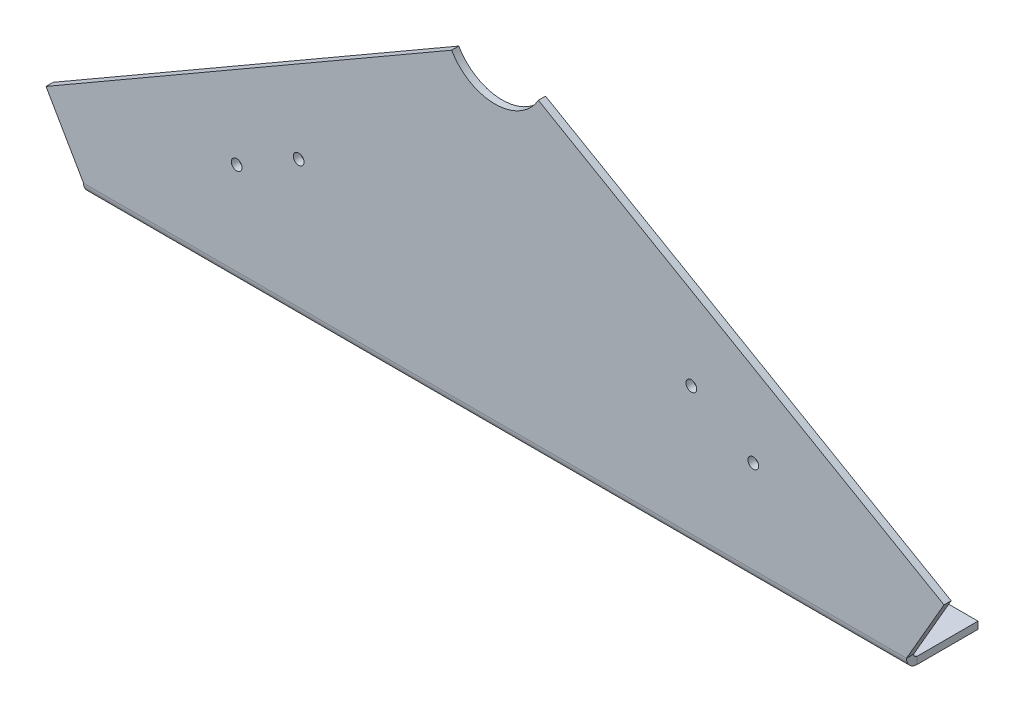
from build123d import *

# Parameters (mm, degrees)
SKETCH_10_R                   = 10
SM_BASE_FLANGE_3_DEPTH        = 2
SM_EDGE_FLANGE_6_DEPTH        = 230
SM_EDGE_FLANGE_6_BEND_DEPTH   = 230
SM_EDGE_FLANGE_6_BEND_2_DEPTH = 230
CUT_EXTRUDE_4_REACH           = 363.137
SKETCH_47_R                   = 2
CUT_EXTRUDE_6_REACH           = 263.424
SKETCH_50_R                   = 2
CUT_EXTRUDE_7_REACH           = 351.772
SKETCH_51_R                   = 2
CUT_EXTRUDE_8_REACH           = 349.61
SKETCH_52_R                   = 14
SKETCH_53_R                   = 1.5
CUT_EXTRUDE_9_DEPTH           = 10
OTHER_START                   = -20
OTHER_1_OUTLINE_R             = 1.5
OTHER_1_OUTLINE_R_2           = 10
OTHER_1_DEPTH                 = 20


# Read off the part's stored shape, not the designer's step: Полость1
# Sheet-metal steps are written as plain solids
with BuildPart() as part:
    # Эскиз10 → Базовая кромка3 (new body)
    with BuildSketch(Plane.XY):
        Polygon((0, 0), (-21, 36.373066959), (94, 235.558909829), (136, 235.558909829), (251, 36.373066959), (230, 0), align=None)
        with Locations((171.849364905, 123.465988394)):
            Circle(SKETCH_10_R, mode=Mode.SUBTRACT)
    extrude(amount=-SM_BASE_FLANGE_3_DEPTH)

    # Ребро-кромка6 section (across the edge) → Ребро-кромка6 (add)
    with BuildSketch(Plane(origin=(-21.866025404, 36.873066959, -2), x_dir=(0.8660254037844436, -0.4999999999999914, -3.4914813388431334e-15), z_dir=(0.4999999999999914, 0.8660254037844436, 0))):
        with BuildLine():
            Line((-2, 1), (-2, 18))
            Line((-2, 18), (0, 18))
            Line((0, 18), (0, 1))
            ThreePointArc((0, 1), (0.292893219, 0.292893219), (1, 0))
            Line((1, 0), (1, -2))
            ThreePointArc((1, -2), (-1.121320344, -1.121320344), (-2, 1))
        make_face()
    extrude(amount=SM_EDGE_FLANGE_6_DEPTH)

    # Ребро-кромка6 section 2 (across the edge) → Ребро-кромка6 bend (add)
    with BuildSketch(Plane(origin=(136.866025404, 236.058909829, -2), x_dir=(-0.8660254037844363, -0.5000000000000041, -3.4914813388431334e-15), z_dir=(0.5000000000000041, -0.8660254037844363, 0))):
        with BuildLine():
            Line((-2, 1), (-2, 18))
            Line((-2, 18), (0, 18))
            Line((0, 18), (0, 1))
            ThreePointArc((0, 1), (0.292893219, 0.292893219), (1, 0))
            Line((1, 0), (1, -2))
            ThreePointArc((1, -2), (-1.121320344, -1.121320344), (-2, 1))
        make_face()
    extrude(amount=SM_EDGE_FLANGE_6_BEND_DEPTH)

    # Ребро-кромка6 section 3 (across the edge) → Ребро-кромка6 bend 2 (add)
    with BuildSketch(Plane(origin=(230, -1, -2), x_dir=(0, 1, 0), z_dir=(-1, 0, 0))):
        with BuildLine():
            Line((-2, 1), (-2, 18))
            Line((-2, 18), (0, 18))
            Line((0, 18), (0, 1))
            ThreePointArc((0, 1), (0.292893219, 0.292893219), (1, 0))
            Line((1, 0), (1, -2))
            ThreePointArc((1, -2), (-1.121320344, -1.121320344), (-2, 1))
        make_face()
    extrude(amount=SM_EDGE_FLANGE_6_BEND_2_DEPTH)

    # Эскиз47 → Вырез-Вытянуть4 (cut, up to next)
    with BuildSketch(Plane(origin=(-34.098076211, 19.686533479, 0), x_dir=(0, 0, 1), z_dir=(-0.866025403784443, 0.4999999999999925, 3.788649256556814e-15)), mode=Mode.PRIVATE) as cut_extrude_4_sk1:
        with Locations(Location((-11.5, 29, 0), (0, 0, 270))):
            Circle(SKETCH_47_R)
    cut_extrude_4_tool1 = extrude(cut_extrude_4_sk1.sketch, amount=-CUT_EXTRUDE_4_REACH, mode=Mode.PRIVATE) & part.part
    # Эскиз47 → Вырез-Вытянуть4 (cut, up to next)
    with BuildSketch(Plane(origin=(-34.098076211, 19.686533479, 0), x_dir=(0, 0, 1), z_dir=(-0.866025403784443, 0.4999999999999925, 3.788649256556814e-15)), mode=Mode.PRIVATE) as cut_extrude_4_sk2:
        with Locations(Location((-11.5, 39, 0), (0, 0, 270))):
            Circle(SKETCH_47_R)
    cut_extrude_4_tool2 = extrude(cut_extrude_4_sk2.sketch, amount=-CUT_EXTRUDE_4_REACH, mode=Mode.PRIVATE) & part.part
    # Эскиз47 → Вырез-Вытянуть4 (cut, up to next)
    with BuildSketch(Plane(origin=(-34.098076211, 19.686533479, 0), x_dir=(0, 0, 1), z_dir=(-0.866025403784443, 0.4999999999999925, 3.788649256556814e-15)), mode=Mode.PRIVATE) as cut_extrude_4_sk3:
        with Locations(Location((-11.5, 233, 0), (0, 0, 270))):
            Circle(SKETCH_47_R)
    cut_extrude_4_tool3 = extrude(cut_extrude_4_sk3.sketch, amount=-CUT_EXTRUDE_4_REACH, mode=Mode.PRIVATE) & part.part
    # Эскиз47 → Вырез-Вытянуть4 (cut, up to next)
    with BuildSketch(Plane(origin=(-34.098076211, 19.686533479, 0), x_dir=(0, 0, 1), z_dir=(-0.866025403784443, 0.4999999999999925, 3.788649256556814e-15)), mode=Mode.PRIVATE) as cut_extrude_4_sk4:
        with Locations(Location((-11.5, 243, 0), (0, 0, 270))):
            Circle(SKETCH_47_R)
    cut_extrude_4_tool4 = extrude(cut_extrude_4_sk4.sketch, amount=-CUT_EXTRUDE_4_REACH, mode=Mode.PRIVATE) & part.part
    add(cut_extrude_4_tool1.solids().sort_by_distance((-19.598076, 44.80127, -11.5))[0], mode=Mode.SUBTRACT)
    add(cut_extrude_4_tool2.solids().sort_by_distance((-14.598076, 53.461524, -11.5))[0], mode=Mode.SUBTRACT)
    add(cut_extrude_4_tool3.solids().sort_by_distance((82.401924, 221.470453, -11.5))[0], mode=Mode.SUBTRACT)
    add(cut_extrude_4_tool4.solids().sort_by_distance((87.401924, 230.130707, -11.5))[0], mode=Mode.SUBTRACT)

    # Эскиз50 → Вырез-Вытянуть6 (cut, up to next)
    with BuildSketch(Plane(origin=(206.598076211, 119.279454915, 0), x_dir=(0, 0, -1), z_dir=(0.866025403784436, 0.5000000000000047, 3.0623287353932815e-15)), mode=Mode.PRIVATE) as cut_extrude_6_sk1:
        with Locations(Location((11.5, -86, 0), (0, 0, 90))):
            Circle(SKETCH_50_R)
    cut_extrude_6_tool1 = extrude(cut_extrude_6_sk1.sketch, amount=-CUT_EXTRUDE_6_REACH, mode=Mode.PRIVATE) & part.part
    # Эскиз50 → Вырез-Вытянуть6 (cut, up to next)
    with BuildSketch(Plane(origin=(206.598076211, 119.279454915, 0), x_dir=(0, 0, -1), z_dir=(0.866025403784436, 0.5000000000000047, 3.0623287353932815e-15)), mode=Mode.PRIVATE) as cut_extrude_6_sk2:
        with Locations(Location((11.5, -76, 0), (0, 0, 90))):
            Circle(SKETCH_50_R)
    cut_extrude_6_tool2 = extrude(cut_extrude_6_sk2.sketch, amount=-CUT_EXTRUDE_6_REACH, mode=Mode.PRIVATE) & part.part
    # Эскиз50 → Вырез-Вытянуть6 (cut, up to next)
    with BuildSketch(Plane(origin=(206.598076211, 119.279454915, 0), x_dir=(0, 0, -1), z_dir=(0.866025403784436, 0.5000000000000047, 3.0623287353932815e-15)), mode=Mode.PRIVATE) as cut_extrude_6_sk3:
        with Locations(Location((11.5, 118, 0), (0, 0, 90))):
            Circle(SKETCH_50_R)
    cut_extrude_6_tool3 = extrude(cut_extrude_6_sk3.sketch, amount=-CUT_EXTRUDE_6_REACH, mode=Mode.PRIVATE) & part.part
    # Эскиз50 → Вырез-Вытянуть6 (cut, up to next)
    with BuildSketch(Plane(origin=(206.598076211, 119.279454915, 0), x_dir=(0, 0, -1), z_dir=(0.866025403784436, 0.5000000000000047, 3.0623287353932815e-15)), mode=Mode.PRIVATE) as cut_extrude_6_sk4:
        with Locations(Location((11.5, 128, 0), (0, 0, 90))):
            Circle(SKETCH_50_R)
    cut_extrude_6_tool4 = extrude(cut_extrude_6_sk4.sketch, amount=-CUT_EXTRUDE_6_REACH, mode=Mode.PRIVATE) & part.part
    add(cut_extrude_6_tool1.solids().sort_by_distance((249.598076, 44.80127, -11.5))[0], mode=Mode.SUBTRACT)
    add(cut_extrude_6_tool2.solids().sort_by_distance((244.598076, 53.461524, -11.5))[0], mode=Mode.SUBTRACT)
    add(cut_extrude_6_tool3.solids().sort_by_distance((147.598076, 221.470453, -11.5))[0], mode=Mode.SUBTRACT)
    add(cut_extrude_6_tool4.solids().sort_by_distance((142.598076, 230.130707, -11.5))[0], mode=Mode.SUBTRACT)

    # Эскиз51 → Вырез-Вытянуть7 (cut, up to next)
    with BuildSketch(Plane.XZ.offset(3), mode=Mode.PRIVATE) as cut_extrude_7_sk1:
        with Locations(Location((222, -11.5, 0), (0, 0, 270))):
            Circle(SKETCH_51_R)
    cut_extrude_7_tool1 = extrude(cut_extrude_7_sk1.sketch, amount=-CUT_EXTRUDE_7_REACH, mode=Mode.PRIVATE) & part.part
    # Эскиз51 → Вырез-Вытянуть7 (cut, up to next)
    with BuildSketch(Plane.XZ.offset(3), mode=Mode.PRIVATE) as cut_extrude_7_sk2:
        with Locations(Location((212, -11.5, 0), (0, 0, 270))):
            Circle(SKETCH_51_R)
    cut_extrude_7_tool2 = extrude(cut_extrude_7_sk2.sketch, amount=-CUT_EXTRUDE_7_REACH, mode=Mode.PRIVATE) & part.part
    # Эскиз51 → Вырез-Вытянуть7 (cut, up to next)
    with BuildSketch(Plane.XZ.offset(3), mode=Mode.PRIVATE) as cut_extrude_7_sk3:
        with Locations(Location((18, -11.5, 0), (0, 0, 270))):
            Circle(SKETCH_51_R)
    cut_extrude_7_tool3 = extrude(cut_extrude_7_sk3.sketch, amount=-CUT_EXTRUDE_7_REACH, mode=Mode.PRIVATE) & part.part
    # Эскиз51 → Вырез-Вытянуть7 (cut, up to next)
    with BuildSketch(Plane.XZ.offset(3), mode=Mode.PRIVATE) as cut_extrude_7_sk4:
        with Locations(Location((8, -11.5, 0), (0, 0, 270))):
            Circle(SKETCH_51_R)
    cut_extrude_7_tool4 = extrude(cut_extrude_7_sk4.sketch, amount=-CUT_EXTRUDE_7_REACH, mode=Mode.PRIVATE) & part.part
    add(cut_extrude_7_tool1.solids().sort_by_distance((222, -3, -11.5))[0], mode=Mode.SUBTRACT)
    add(cut_extrude_7_tool2.solids().sort_by_distance((212, -3, -11.5))[0], mode=Mode.SUBTRACT)
    add(cut_extrude_7_tool3.solids().sort_by_distance((18, -3, -11.5))[0], mode=Mode.SUBTRACT)
    add(cut_extrude_7_tool4.solids().sort_by_distance((8, -3, -11.5))[0], mode=Mode.SUBTRACT)

    # Эскиз52 → Вырез-Вытянуть8 (cut, up to next)
    with BuildSketch(Plane(origin=(0, 0, -2), x_dir=(-1, 0, 0), z_dir=(0, 0, -1)), mode=Mode.PRIVATE) as cut_extrude_8_sk1:
        with Locations((-115, 90.643992263)):
            Circle(SKETCH_52_R)
    cut_extrude_8_tool1 = extrude(cut_extrude_8_sk1.sketch, amount=-CUT_EXTRUDE_8_REACH, mode=Mode.PRIVATE) & part.part
    add(cut_extrude_8_tool1.solids().sort_by_distance((115, 90.643992, -2))[0], mode=Mode.SUBTRACT)

    # Эскиз53 → Вырез-Вытянуть9 (cut)
    with BuildSketch(Plane(origin=(0, 0, -2), x_dir=(-1, 0, 0), z_dir=(0, 0, -1))):
        with Locations((-40.121778265, 70.507041555)):
            Circle(SKETCH_53_R)
        with Locations((-22.801270189, 60.507041555)):
            Circle(SKETCH_53_R)
        with Locations((-60.121778265, 35.866025404)):
            Circle(SKETCH_53_R)
        with Locations((-42.801270189, 25.866025404)):
            Circle(SKETCH_53_R)
        with Locations((-95, 185.558909829)):
            Circle(SKETCH_53_R)
        with Locations((-95, 165.558909829)):
            Circle(SKETCH_53_R)
        with Locations((-135, 185.558909829)):
            Circle(SKETCH_53_R)
        with Locations((-135, 165.558909829)):
            Circle(SKETCH_53_R)
        with Locations((-207.198729811, 60.507041555)):
            Circle(SKETCH_53_R)
        with Locations((-189.878221735, 70.507041555)):
            Circle(SKETCH_53_R)
        with Locations((-187.198729811, 25.866025404)):
            Circle(SKETCH_53_R)
        with Locations((-169.878221735, 35.866025404)):
            Circle(SKETCH_53_R)
    extrude(amount=-CUT_EXTRUDE_9_DEPTH, mode=Mode.SUBTRACT)

    # Полость1 outline → Полость1 (cut)
    with BuildSketch(Plane.XY.offset(OTHER_START)):
        with BuildLine():
            Line((127.120094671, 83.636617208), (240.495741262, 18.17915713))
            Line((240.495741262, 18.17915713), (251, 36.373066959))
            Line((251, 36.373066959), (253.598076211, 37.873066959))
            Line((253.598076211, 37.873066959), (138.598076211, 237.058909829))
            Line((138.598076211, 237.058909829), (136, 235.558909829))
            Line((136, 235.558909829), (94, 235.558909829))
            Line((94, 235.558909829), (91.401923789, 237.058909829))
            Line((91.401923789, 237.058909829), (-23.598076211, 37.873066959))
            Line((-23.598076211, 37.873066959), (-21, 36.373066959))
            Line((-21, 36.373066959), (-10.495741262, 18.17915713))
            Line((-10.495741262, 18.17915713), (102.879905329, 83.636617208))
            ThreePointArc((102.879905329, 83.636617208), (115, 104.643992263), (127.120094671, 83.636617208))
        make_face()
        with Locations((22.801270189, 60.507041555)):
            Circle(OTHER_1_OUTLINE_R, mode=Mode.SUBTRACT)
        with Locations((40.121778265, 70.507041555)):
            Circle(OTHER_1_OUTLINE_R, mode=Mode.SUBTRACT)
        with Locations((189.878221735, 70.507041555)):
            Circle(OTHER_1_OUTLINE_R, mode=Mode.SUBTRACT)
        with Locations((207.198729811, 60.507041555)):
            Circle(OTHER_1_OUTLINE_R, mode=Mode.SUBTRACT)
        with Locations((171.849364905, 123.465988394)):
            Circle(OTHER_1_OUTLINE_R_2, mode=Mode.SUBTRACT)
        with Locations((95, 165.558909829)):
            Circle(OTHER_1_OUTLINE_R, mode=Mode.SUBTRACT)
        with Locations((95, 185.558909829)):
            Circle(OTHER_1_OUTLINE_R, mode=Mode.SUBTRACT)
        with Locations((135, 165.558909829)):
            Circle(OTHER_1_OUTLINE_R, mode=Mode.SUBTRACT)
        with Locations((135, 185.558909829)):
            Circle(OTHER_1_OUTLINE_R, mode=Mode.SUBTRACT)
    extrude(amount=OTHER_1_DEPTH, mode=Mode.SUBTRACT)


solid = part.part
